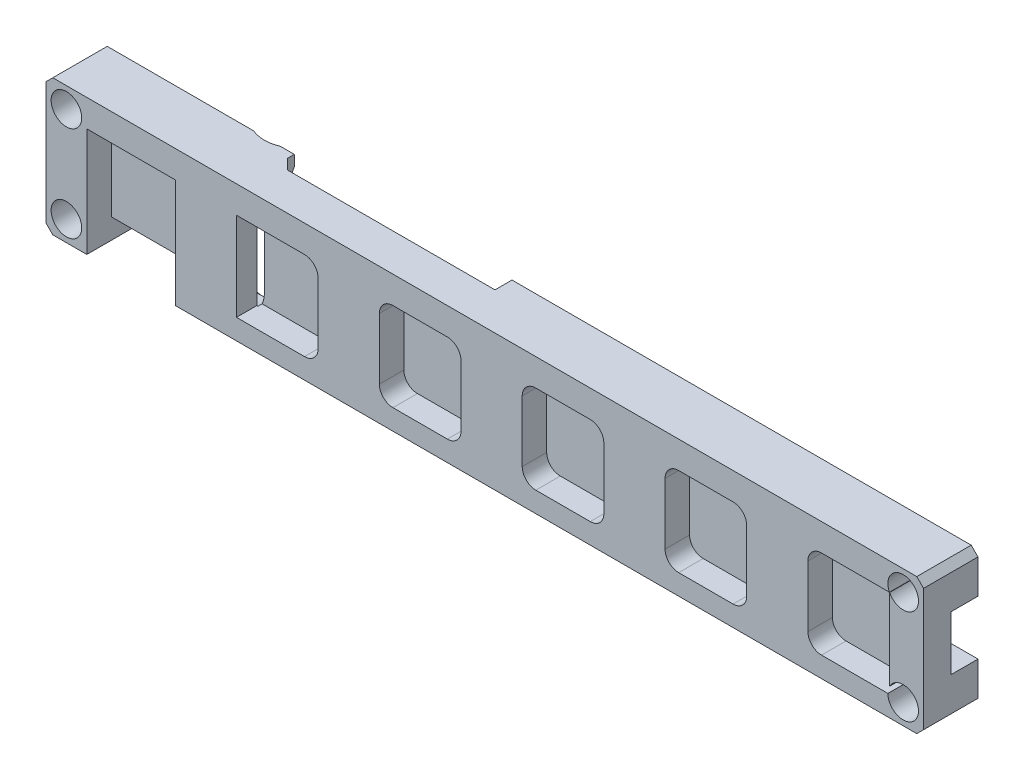
from build123d import *

# Parameters (mm, degrees)
SKETCH1_W               = 129
SKETCH1_H               = 20
BOSS_EXTRUDE1_DEPTH     = 8
SKETCH2_W               = 13
SKETCH2_H               = 15
SKETCH2_W_2             = 12
SKETCH2_H_2             = 13
CUT_EXTRUDE4_DEPTH      = 3.6
SKETCH2_5_R             = 2.25
CUT_EXTRUDE7_DEPTH      = 131.786084887
CUT_EXTRUDE8_DEPTH      = 131.615313038
CUT_EXTRUDE8_DEPTH_BACK = 131.615313038
SKETCH3_W               = 13
SKETCH3_H               = 3
CUT_EXTRUDE9_DEPTH      = 5
CHAMFER1_SIZE           = 1
SKETCH5_W               = 42
SKETCH5_H               = 20
SKETCH5_W_2             = 2
SKETCH5_H_2             = 8
CUT_EXTRUDE10_DEPTH     = 2.5
CHAMFER2_DEPTH          = 20
SKETCH6_W               = 5
SKETCH6_H               = 4.5
SKETCH6_W_2             = 8
SKETCH6_H_2             = 3.5
CUT_EXTRUDE11_DEPTH     = 4
SKETCH7_W               = 20
SKETCH7_H               = 4
SKETCH7_W_2             = 10
SKETCH7_W_3             = 5
SKETCH7_H_2             = 5
BOSS_EXTRUDE2_DEPTH     = 2.5
CHAMFER3_SIZE           = 1
FILLET1_R               = 2
CHAMFER4_SIZE           = 1


with BuildPart() as part:
    # Sketch1 → Boss-Extrude1 (new body)
    with BuildSketch(Plane.XY):
        with Locations((64.5, 10)):
            Rectangle(SKETCH1_W, SKETCH1_H)
    extrude(amount=BOSS_EXTRUDE1_DEPTH)

    # Sketch2 → Cut-Extrude4 (cut)
    with BuildSketch(Plane.XY.offset(8)):
        with Locations((12.5, 8.5)):
            Rectangle(SKETCH2_W, SKETCH2_H)
        with Locations((55, 9.5)):
            Rectangle(SKETCH2_W_2, SKETCH2_H_2)
        with Locations((34, 9.5)):
            Rectangle(SKETCH2_W_2, SKETCH2_H_2)
        with Locations((76, 9.5)):
            Rectangle(SKETCH2_W_2, SKETCH2_H_2)
        with Locations((97, 9.5)):
            Rectangle(SKETCH2_W_2, SKETCH2_H_2)
        with BuildLine():
            Line((112, 16), (112, 3))
            Line((112, 3), (123.75, 3))
            ThreePointArc((123.75, 3), (123.813393039, 3.530330086), (124, 4.030776406))
            Line((124, 4.030776406), (124, 15.969223594))
            ThreePointArc((124, 15.969223594), (123.992158813, 15.984581975), (123.984435563, 16))
            Line((123.984435563, 16), (112, 16))
        make_face()
    extrude(amount=-CUT_EXTRUDE4_DEPTH, mode=Mode.SUBTRACT)

    # Sketch2<5> → Cut-Extrude7 (cut, through all)
    with BuildSketch(Plane.XY.offset(8)):
        with Locations((126, 3)):
            Circle(SKETCH2_5_R)
        with Locations((126, 17)):
            Circle(SKETCH2_5_R)
        with Locations((3, 17)):
            Circle(SKETCH2_5_R)
        with Locations((3, 3)):
            Circle(SKETCH2_5_R)
    extrude(amount=-CUT_EXTRUDE7_DEPTH, mode=Mode.SUBTRACT)

    # Sketch3 → Cut-Extrude8 (cut, two sides: drawn at the far end of the back side and taken through both)
    with BuildSketch(Plane.XY.offset(4.4).offset(-CUT_EXTRUDE8_DEPTH_BACK)):
        with Locations((12.5, 1.5)):
            Rectangle(SKETCH3_W, SKETCH3_H)
    extrude(amount=CUT_EXTRUDE8_DEPTH + CUT_EXTRUDE8_DEPTH_BACK, mode=Mode.SUBTRACT)

    # Sketch4 → Cut-Extrude9 (cut)
    with BuildSketch(Plane(origin=(0, 0, 0), x_dir=(-1, 0, 0), z_dir=(0, 0, -1))):
        with BuildLine():
            Line((-28.5, 4.596136616), (-28.5, 15.403863384))
            ThreePointArc((-28.5, 15.403863384), (-24.5, 19.403863384), (-20.5, 15.403863384))
            Line((-20.5, 15.403863384), (-20.5, 4.596136616))
            ThreePointArc((-20.5, 4.596136616), (-24.5, 0.596136616), (-28.5, 4.596136616))
        make_face()
    extrude(amount=-CUT_EXTRUDE9_DEPTH, mode=Mode.SUBTRACT)

    # Chamfer1
    # the kernel refuses this chamfer: 1 mm, written as the material it takes off along each edge
    with BuildSketch(Plane(origin=(24.5, 4.596136616, 0), x_dir=(-1, 0, 0), z_dir=(0, 1, 0))) as chamfer1_piece_1:
        Polygon((4 + CHAMFER1_SIZE, 0), (4, CHAMFER1_SIZE), (4, 0), align=None)
    revolve(axis=Axis((24.5, 4.596136616, 0), (0, 0, 1)), revolution_arc=180, mode=Mode.SUBTRACT)
    with BuildSketch(Plane(origin=(20.5, 15.403863384, 0), x_dir=(-1, 0, 0), z_dir=(0, -1, 0)), Plane(origin=(28.5, 4.596136616, 0), x_dir=(1, 0, 0), z_dir=(0, 1, 0))) as chamfer1_piece_2:
        Polygon((CHAMFER1_SIZE, 0), (0, -CHAMFER1_SIZE), (0, 0), align=None)
    extrude(amount=10.807726767, mode=Mode.SUBTRACT)
    with BuildSketch(Plane(origin=(24.5, 15.403863384, 0), x_dir=(1, 0, 0), z_dir=(0, -1, 0))) as chamfer1_piece_3:
        Polygon((4 + CHAMFER1_SIZE, 0), (4, CHAMFER1_SIZE), (4, 0), align=None)
    revolve(axis=Axis((24.5, 15.403863384, 0), (0, 0, 1)), revolution_arc=180, mode=Mode.SUBTRACT)

    # Sketch5 → Cut-Extrude10 (cut)
    with BuildSketch(Plane(origin=(0, 0, 0), x_dir=(-1, 0, 0), z_dir=(0, 0, -1))):
        with Locations((-49.5, 10)):
            Rectangle(SKETCH5_W, SKETCH5_H)
        with Locations((-1, 10)):
            Rectangle(SKETCH5_W_2, SKETCH5_H_2)
    extrude(amount=-CUT_EXTRUDE10_DEPTH, mode=Mode.SUBTRACT)

    # Chamfer2: read off the stored shape, not the designer's step
    # Chamfer2 outline → Chamfer2 (add)
    with BuildSketch(Plane(origin=(0, 0, 0), x_dir=(1, 0, 0), z_dir=(0, 1, 0))):
        Polygon((28.5, -1), (28.5, -2.5), (30, -2.5), align=None)
    extrude(amount=CHAMFER2_DEPTH)

    # Sketch6 → Cut-Extrude11 (cut)
    with BuildSketch(Plane(origin=(0, 0, 0), x_dir=(-1, 0, 0), z_dir=(0, 0, -1))):
        with Locations((-88.5, 4.75)):
            Rectangle(SKETCH6_W, SKETCH6_H)
        Polygon((-113, 2.5), (-108, 2.5), (-108, 12.5), (-113, 12.5), (-113, 10), (-113, 6), align=None)
        with Locations((-117, 4.25)):
            Rectangle(SKETCH6_W_2, SKETCH6_H_2)
        Polygon((-121, 6), (-113, 6), (-113, 10), (-129, 10), (-129, 6), align=None)
        Polygon((-113, 10), (-113, 12.5), (-113, 14), (-129, 14), (-129, 10), align=None)
    extrude(amount=-CUT_EXTRUDE11_DEPTH, mode=Mode.SUBTRACT)

    # Sketch7 → Boss-Extrude2 (add)
    with BuildSketch(Plane(origin=(0, 0, 2.5), x_dir=(-1, 0, 0), z_dir=(0, 0, -1))):
        with Locations((-60.5, 2)):
            Rectangle(SKETCH7_W, SKETCH7_H)
        with Locations((-65.5, 18)):
            Rectangle(SKETCH7_W_2, SKETCH7_H)
        with Locations((-43.5, 8.5)):
            Rectangle(SKETCH7_W_3, SKETCH7_H_2)
    extrude(amount=BOSS_EXTRUDE2_DEPTH)

    # Chamfer3
    chamfer3_edges = [part.edges().sort_by_distance(p)[0] for p in [
        (0, 14, 1.25),
        (0, 6, 1.25),
    ]]
    chamfer(chamfer3_edges, length=CHAMFER3_SIZE)

    # Fillet1
    fillet1_edges = [part.edges().sort_by_distance(p)[0] for p in [
        (112, 3, 6.2),
        (112, 16, 6.2),
        (70, 16, 6.2),
        (82, 16, 6.2),
        (82, 3, 6.2),
        (70, 3, 6.2),
        (40, 16, 6.2),
        (40, 3, 6.2),
        (61, 16, 6.2),
        (61, 3, 6.2),
        (49, 3, 6.2),
        (49, 16, 6.2),
        (103, 16, 6.2),
        (103, 3, 6.2),
        (91, 3, 6.2),
        (91, 16, 6.2),
    ]]
    fillet(fillet1_edges, radius=FILLET1_R)

    # Chamfer4
    chamfer4_edges = [part.edges().sort_by_distance(p)[0] for p in [
        (0, 20, 4),
        (129, 20, 4),
        (129, 0, 4),
        (0, 0, 4),
    ]]
    chamfer(chamfer4_edges, length=CHAMFER4_SIZE)


solid = part.part
